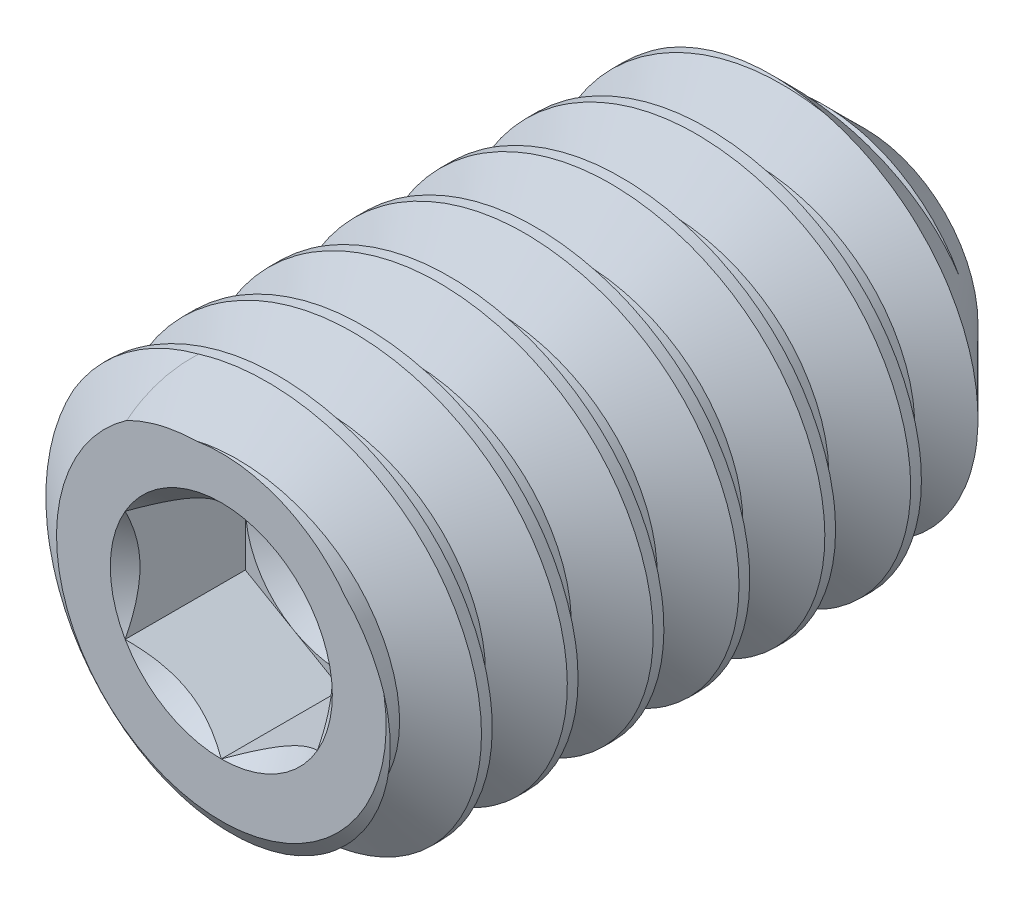
from build123d import *

# Parameters (mm, degrees)
CUT_SWEEP2_PITCH    = 0.3175
CUT_EXTRUDE10_DEPTH = 0.4445


with BuildPart() as part:
    # Sketch22 → Revolve1 (revolve)
    with BuildSketch(Plane(origin=(0, 0, 0), x_dir=(0, 0, -1), z_dir=(1, 0, 0)), mode=Mode.PRIVATE) as revolve1_sk:
        Polygon((-1.065180547, 0), (-1.065180547, 0.6096), (-0.958468918, 0.762), (0.971618712, 0.762), (1.316069453, 0.417549259), (1.065180547, 0), align=None)
    revolve(revolve1_sk.sketch.rotate(Axis((0, 0, -1.065180547), (0, 0, -1)), 180), axis=Axis((0, 0, -1.065180547), (0, 0, -1)))

    # Cut-Sweep2: the profile of Sketch28 profile screwed along a right-hand helix of 9.3 turns, 6 arcs to a turn; built about Z, then put on its axis
    cut_sweep2_z = Axis((0, 0, 0), (0, 0, 1))
    cut_sweep2_corners = [(0.7623, 0, 0.000173205), (0.7623, 0, -0.277985705), (0.569525854, 0, -0.1666875), (0.569525854, 0, -0.111125)]
    with BuildLine(mode=Mode.PRIVATE) as cut_sweep2_profile:
        Line(cut_sweep2_corners[0], cut_sweep2_corners[1])
        Line(cut_sweep2_corners[1], cut_sweep2_corners[2])
        Line(cut_sweep2_corners[2], cut_sweep2_corners[3])
        Line(cut_sweep2_corners[3], cut_sweep2_corners[0])
    cut_sweep2_cap = Face(cut_sweep2_profile.wire())
    cut_sweep2_turn_angles = [0, 30, 60, 90, 120, 150, 180, 210, 240, 270, 300, 330, 360]
    cut_sweep2_turn_weights = [1, 0.8660254037844387, 1, 0.8660254037844387, 1, 0.8660254037844387, 1, 0.8660254037844387, 1, 0.8660254037844387, 1, 0.8660254037844387, 1]
    cut_sweep2_turn_rails = [Edge.make_bspline([Vector(p[0], p[1], 0).rotate(cut_sweep2_z, cut_sweep2_turn_angles[k]) / cut_sweep2_turn_weights[k] + Vector(0, 0, p[2] + CUT_SWEEP2_PITCH * cut_sweep2_turn_angles[k] / 360) for k in range(13)], [0, 0, 0, 1, 1, 2, 2, 3, 3, 4, 4, 5, 5, 6, 6, 6], 2, cut_sweep2_turn_weights) for p in cut_sweep2_corners]
    cut_sweep2_turn_sides = [Face.make_surface_from_curves(cut_sweep2_turn_rails[p[0]], cut_sweep2_turn_rails[p[1]]) for p in [(0, 1), (1, 2), (2, 3), (3, 0)]]
    cut_sweep2_last_angles = [3240, 3270, 3300, 3324, 3348]
    cut_sweep2_last_weights = [1, 0.8660254037844387, 1, 0.9135454576426251, 1]
    cut_sweep2_last_rails = [Edge.make_bspline([Vector(p[0], p[1], 0).rotate(cut_sweep2_z, cut_sweep2_last_angles[k]) / cut_sweep2_last_weights[k] + Vector(0, 0, p[2] + CUT_SWEEP2_PITCH * cut_sweep2_last_angles[k] / 360) for k in range(5)], [0, 0, 0, 1, 1, 2, 2, 2], 2, cut_sweep2_last_weights) for p in cut_sweep2_corners]
    cut_sweep2_last_sides = [Face.make_surface_from_curves(cut_sweep2_last_rails[p[0]], cut_sweep2_last_rails[p[1]]) for p in [(0, 1), (1, 2), (2, 3), (3, 0)]]
    cut_sweep2 = Plane(origin=(0, 0, -1.316069453), x_dir=(0, 1, 0), z_dir=(0, 0, 1)) * Solid(Shell([*[p.moved(Location((0, 0, CUT_SWEEP2_PITCH * i))) for i in range(9) for p in cut_sweep2_turn_sides], *cut_sweep2_last_sides, cut_sweep2_cap, cut_sweep2_cap.rotate(cut_sweep2_z, 3348).moved(Location((0, 0, CUT_SWEEP2_PITCH * 3348 / 360)))]))
    add(cut_sweep2, mode=Mode.SUBTRACT)

    # Sketch23 → Cut-Extrude10 (cut)
    with BuildSketch(Plane.XY.offset(1.065180547)):
        Polygon((0, 0.410611511), (-0.3556, 0.205305756), (-0.3556, -0.205305756), (0, -0.410611511), (0.3556, -0.205305756), (0.3556, 0.205305756), align=None)
    extrude(amount=-CUT_EXTRUDE10_DEPTH, mode=Mode.SUBTRACT)

    # Cut-Extrude11 cone 1 section (through the dimple's axis) → Cut-Extrude11 (revolve, cut)
    with BuildSketch(Plane(origin=(0, 0, 1.065180547), x_dir=(0, -1, 0), z_dir=(1, 0, 0))):
        Polygon((0, 0), (0.410611511, 0), (0, 0.410611511), align=None)
    revolve(axis=Axis((0, 0, 1.065180547), (0, 0, -1)), mode=Mode.SUBTRACT)

    # Cut-Extrude12 cone 1 section (through the dimple's axis) → Cut-Extrude12 (revolve, cut)
    with BuildSketch(Plane(origin=(0, 0, 0.620680547), x_dir=(0, -1, 0), z_dir=(1, 0, 0))):
        Polygon((0, 0), (0.3556, 0), (0, 0.205305756), align=None)
    revolve(axis=Axis((0, 0, 0.620680547), (0, 0, -1)), mode=Mode.SUBTRACT)


solid = part.part
